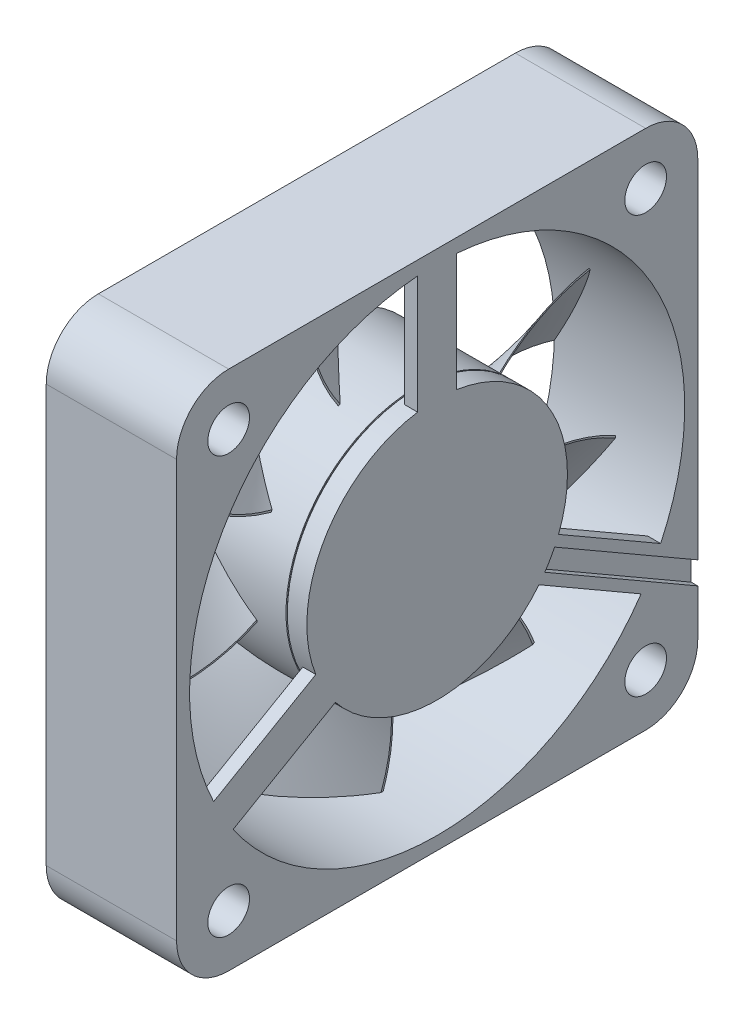
from build123d import *

# Parameters (mm, degrees)
SKETCH_6_W                = 40
SKETCH_6_H                = 40
SKETCH_6_R                = 19
EXTRUDE_1_DEPTH           = 10
FILLET_1_R                = 4
SKETCH_14_R               = 1.6
CUT_EXTRUDE_4_DEPTH       = 31
SKETCH_9_R                = 10
EXTRUDE_3_DEPTH           = 10
EXTRUDE_START             = 9
EXTRUDE_4_DEPTH           = 1
PATTERN_CIRCULAR_1_COUNT  = 3
SWEEP_1_PITCH             = 65
SWEEP_1_HEIGHT            = 5
SWEEP_1_RADIUS            = 10
SWEEP_1_START_ANGLE       = 180
PATTERN_CIRCULAR_4_COUNT  = 9
CUT_EXTRUDE_START         = -0.5
CUT_EXTRUDE_5_DEPTH       = 0.5
CUT_REVOLVE_START         = 8.4
CUT_REVOLVE_1_OUTLINE_R   = 10
CUT_REVOLVE_1_OUTLINE_R_2 = 9.9
CUT_REVOLVE_1_DEPTH       = 0.1


# Read off the part's stored shape, not the designer's step: 切除-旋转1
with BuildPart() as part:
    # 草图6 → 凸台-拉伸1 (new body)
    with BuildSketch(Plane(origin=(0, 0, 0), x_dir=(0, 0, -1), z_dir=(1, 0, 0))):
        Rectangle(SKETCH_6_W, SKETCH_6_H)
        Circle(SKETCH_6_R, mode=Mode.SUBTRACT)
    extrude(amount=EXTRUDE_1_DEPTH)

    # 圆角1
    fillet_1_edges = [part.edges().sort_by_distance(p)[0] for p in [
        (5, 20, 20),
        (5, 20, -20),
        (5, -20, -20),
        (5, -20, 20),
    ]]
    fillet(fillet_1_edges, radius=FILLET_1_R)

    # 草图14 → 切除-拉伸4 (cut, through all)
    with BuildSketch(Plane(origin=(0, 0, 0), x_dir=(0, 0, -1), z_dir=(1, 0, 0))):
        with Locations((16, 16)):
            Circle(SKETCH_14_R)
        with Locations((-16, 16)):
            Circle(SKETCH_14_R)
        with Locations((-16, -16)):
            Circle(SKETCH_14_R)
        with Locations((16, -16)):
            Circle(SKETCH_14_R)
    extrude(amount=CUT_EXTRUDE_4_DEPTH, mode=Mode.SUBTRACT)



with BuildPart() as body_2:
    # 草图9 → 凸台-拉伸3 (new body)
    with BuildSketch(Plane(origin=(0, 0, 0), x_dir=(0, 0, -1), z_dir=(1, 0, 0))):
        Circle(SKETCH_9_R)
    extrude(amount=EXTRUDE_3_DEPTH)


with BuildPart() as part_1:
    add(part.part)

    add(body_2.part)  # 凸台-拉伸4 merges body 2
    # 草图10 → 凸台-拉伸4 (add)
    with BuildSketch(Plane(origin=(0, 0, 0), x_dir=(0, 0, -1), z_dir=(1, 0, 0)).offset(EXTRUDE_START)):
        with BuildLine():
            Line((-1.5, 20), (-1.5, 9.886859967))
            ThreePointArc((-1.5, 9.886859967), (0, 10), (1.5, 9.886859967))
            Line((1.5, 9.886859967), (1.5, 20))
            Line((1.5, 20), (-1.5, 20))
        make_face()
    extrude_4 = extrude(amount=EXTRUDE_4_DEPTH)

    # 阵列(圆周)1: 凸台-拉伸4 ×3 about axis
    pattern_circular_1_axis = Axis((0, 0, 0), (1, 0, 0))
    for i in range(1, PATTERN_CIRCULAR_1_COUNT):
        add(extrude_4.rotate(pattern_circular_1_axis, i * 360 / PATTERN_CIRCULAR_1_COUNT))

    # 扫描1: sweep along a helix
    with BuildLine() as sweep_1_path:
        add(Helix(SWEEP_1_PITCH, SWEEP_1_HEIGHT, SWEEP_1_RADIUS, center=(1, 0, 0), direction=(1, 0, 0), mode=Mode.PRIVATE).rotate(Axis((1, 0, 0), (1, 0, 0)), SWEEP_1_START_ANGLE))
    # 草图13 → 扫描1 (sweep)
    with BuildSketch(Plane(origin=(1, 0, 0), x_dir=(0, 0, -1), z_dir=(1, 0, 0))):
        with BuildLine():
            Line((17.995128369, 0.41875408), (17.995128369, 0.578169689))
            ThreePointArc((17.995128369, 0.578169689), (13.730760081, 1.15988979), (9.49119017, 0.41875408))
            Line((9.49119017, 0.41875408), (9.99119017, 0.41875408))
            ThreePointArc((9.99119017, 0.41875408), (13.993159269, 1.050074146), (17.995128369, 0.41875408))
        make_face()
    sweep_1 = sweep(path=sweep_1_path.line, is_frenet=True)

    # 阵列(圆周)4: 扫描1 ×9 about axis
    pattern_circular_4_axis = Axis((10, 0, 0), (-1, 0, 0))
    for i in range(1, PATTERN_CIRCULAR_4_COUNT):
        add(sweep_1.rotate(pattern_circular_4_axis, i * 360 / PATTERN_CIRCULAR_4_COUNT))

    # 草图20 → 切除-拉伸5 (cut)
    with BuildSketch(Plane(origin=(10, 0, 0), x_dir=(0, 0, -1), z_dir=(1, 0, 0)).offset(CUT_EXTRUDE_START)):
        with BuildLine():
            Line((9.010862725, -4.336398616), (20, -10.68097998))
            Line((20, -10.68097998), (20, -12.413030788))
            Line((20, -12.413030788), (8.260862725, -5.635436722))
            ThreePointArc((8.260862725, -5.635436722), (8.660254038, -5), (9.010862725, -4.336398616))
        make_face()
    extrude(amount=CUT_EXTRUDE_5_DEPTH, mode=Mode.SUBTRACT)

    # 切除-旋转1 outline → 切除-旋转1 (cut)
    with BuildSketch(Plane.YZ.offset(CUT_REVOLVE_START)):
        Circle(CUT_REVOLVE_1_OUTLINE_R)
        Circle(CUT_REVOLVE_1_OUTLINE_R_2, mode=Mode.SUBTRACT)
    extrude(amount=CUT_REVOLVE_1_DEPTH, mode=Mode.SUBTRACT)


solid = part_1.part
